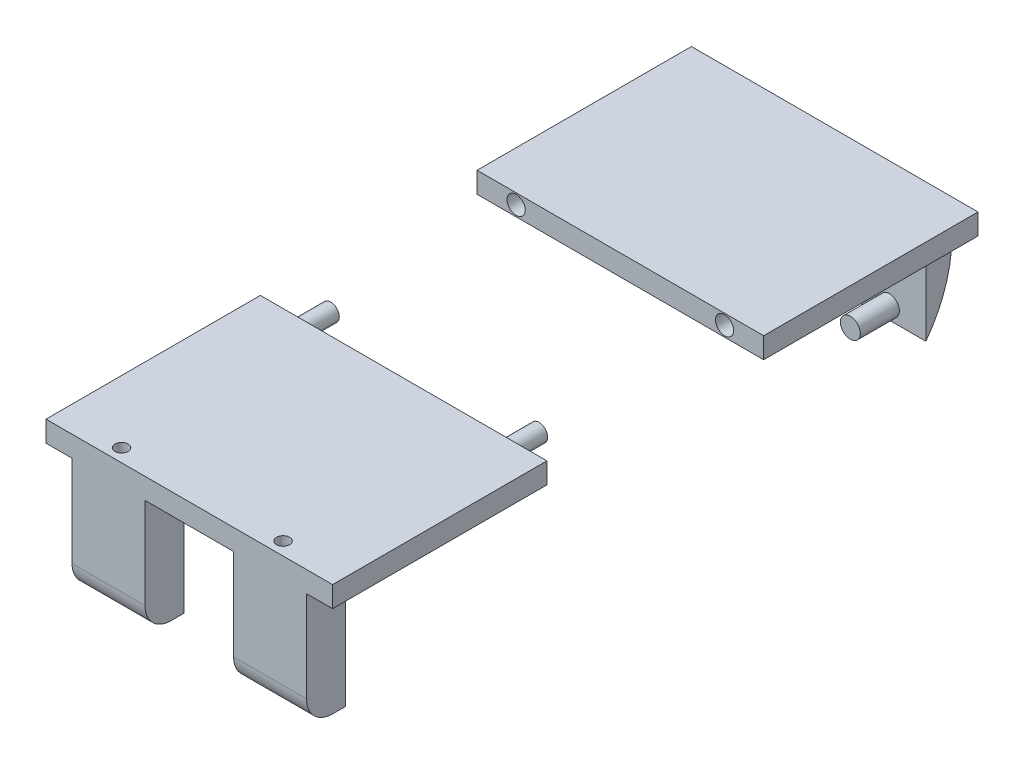
from build123d import *

# Parameters (mm, degrees)
SKETCH_1_W             = 110
SKETCH_1_H             = 8
EXTRUDE_1_DEPTH        = 164.55
SKETCH_7_W             = 28
SKETCH_7_H             = 15
EXTRUDE_2_DEPTH        = 45
FILLET_1_R             = 10
SKETCH_10_R            = 12.415
CUT_EXTRUDE_3_DEPTH    = 10
SKETCH_11_R            = 2.5
CUT_EXTRUDE_4_DEPTH    = 30
FILLET_1_OF_MIRROR_1_R = 10
SKETCH_13_W            = 28
SKETCH_13_H            = 10
EXTRUDE_3_DEPTH        = 35
FILLET_2_R             = 50
SKETCH_14_R            = 3.825
EXTRUDE_4_DEPTH        = 15
MIRROR_START           = -44.153846154
MIRROR_2_DEPTH         = 28
MIRROR_START_2         = 10
MIRROR_2_2_OUTLINE_R   = 3.825
MIRROR_2_2_DEPTH       = 15
SKETCH5_R              = 3.5
CUT_EXTRUDE2_DEPTH     = 15
SKETCH6_R              = 3.3
BOSS_EXTRUDE1_DEPTH    = 12


with BuildPart() as part:
    # Эскиз1 → Бобышка-Вытянуть1 (new body)
    with BuildSketch(Plane.XY):
        with Locations((0.846153846, 10.153846154)):
            Rectangle(SKETCH_1_W, SKETCH_1_H)
    extrude(amount=EXTRUDE_1_DEPTH)

    # Эскиз7 → Бобышка-Вытянуть2 (add)
    with BuildSketch(Plane.XZ.offset(-6.153846154)):
        with Locations((31.846153846, 157.05)):
            Rectangle(SKETCH_7_W, SKETCH_7_H)
    extrude_2 = extrude(amount=EXTRUDE_2_DEPTH)

    # Скругление1
    fillet_1_edges = [part.edges().sort_by_distance(p)[0] for p in [
        (31.846153846, -38.846153846, 164.55),
    ]]
    fillet(fillet_1_edges, radius=FILLET_1_R)

    # Эскиз10 → Вырез-Вытянуть3 (cut)
    with BuildSketch(Plane(origin=(0, 0, 149.55), x_dir=(-1, 0, 0), z_dir=(0, 0, -1))):
        with Locations((-31.846153846, -22.506407884)):
            Circle(SKETCH_10_R)
    cut_extrude_3 = extrude(amount=-CUT_EXTRUDE_3_DEPTH, mode=Mode.SUBTRACT)

    # Эскиз11 → Вырез-Вытянуть4 (cut)
    with BuildSketch(Plane(origin=(0, 14.153846154, 0), x_dir=(1, 0, 0), z_dir=(0, 1, 0))):
        with Locations(Location((31.846153846, -159.55, 0), (0, 0, 270))):
            Circle(SKETCH_11_R)
    cut_extrude_4 = extrude(amount=-CUT_EXTRUDE_4_DEPTH, mode=Mode.SUBTRACT)

    # Зеркальное отражение1: Бобышка-Вытянуть2, Вырез-Вытянуть3, Вырез-Вытянуть4 across plane
    add(extrude_2.mirror(Plane.ZY.offset(-0.846153846)))
    add(cut_extrude_3.mirror(Plane.ZY.offset(-0.846153846)), mode=Mode.SUBTRACT)
    add(cut_extrude_4.mirror(Plane.ZY.offset(-0.846153846)), mode=Mode.SUBTRACT)

    # Скругление1 of Зеркальное отражение1
    fillet_1_of_mirror_1_edges = [part.edges().sort_by_distance(p)[0] for p in [
        (-30.153846154, -38.846153846, 164.55),
    ]]
    fillet(fillet_1_of_mirror_1_edges, radius=FILLET_1_OF_MIRROR_1_R)

    # Эскиз13 → Бобышка-Вытянуть3 (add)
    with BuildSketch(Plane(origin=(0, 6.153846154, 0), x_dir=(-1, 0, 0), z_dir=(0, -1, 0))):
        with Locations((-31.846153846, -5)):
            Rectangle(SKETCH_13_W, SKETCH_13_H)
    extrude(amount=EXTRUDE_3_DEPTH)

    # Скругление2
    # the kernel refuses this fillet: 50 mm, written as the material it takes off along each edge
    with BuildSketch(Plane(origin=(-57.153846154, -28.846153846, 0), x_dir=(0, 1, 0), z_dir=(1, 0, 0))) as fillet_2_piece_1:
        with BuildLine():
            CenterArc((30, 50), FILLET_2_R, 233.130102354, 36.869897646)
            Line((0, 10), (0, 0))
            Line((0, 0), (30, 0))
        make_face()
    extrude(amount=178, mode=Mode.SUBTRACT)

    # Эскиз14 → Бобышка-Вытянуть4 (add)
    with BuildSketch(Plane.XY.offset(10)):
        with Locations(Location((31.846153846, -23.846153846, 0), (0, 0, 180))):
            Circle(SKETCH_14_R)
    extrude(amount=EXTRUDE_4_DEPTH)

    # Зеркальное отражение2: read off the stored shape, not the designer's step
    # Зеркальное отражение2 outline → Зеркальное отражение2 (add)
    with BuildSketch(Plane.YZ.offset(MIRROR_START)):
        with BuildLine():
            Line((1.153846154, 0), (6.153846154, 0))
            Line((6.153846154, 0), (6.153846154, 10))
            Line((6.153846154, 10), (-28.846153846, 10))
            ThreePointArc((-28.846153846, 10), (-14.657542147, 2.565835097), (1.153846154, 0))
        make_face()
    extrude(amount=MIRROR_2_DEPTH)

    # Mirror 2 2 outline → Mirror 2 2 (add)
    with BuildSketch(Plane.XY.offset(MIRROR_START_2)):
        with Locations((-30.153846154, -23.846153846)):
            Circle(MIRROR_2_2_OUTLINE_R)
    extrude(amount=MIRROR_2_2_DEPTH)


with BuildPart() as body_2:
    # Split1: the piece on the far side of the plane
    add(part.part)
    split(bisect_by=Plane(origin=(0, 0, 82.275), x_dir=(-1, 0, 0), z_dir=(0, 0, -1)), keep=Keep.BOTTOM)

    # Sketch6 → Boss-Extrude1 (add)
    with BuildSketch(Plane(origin=(0, 0, 82.275), x_dir=(-1, 0, 0), z_dir=(0, 0, -1))):
        with Locations((39.153846154, 10.153846154)):
            Circle(SKETCH6_R)
    boss_extrude1 = extrude(amount=BOSS_EXTRUDE1_DEPTH)

    # Mirror2: Boss-Extrude1 across plane
    add(boss_extrude1.mirror(Plane.ZY.offset(-0.846153846)))


with BuildPart() as part_1:
    add(part.part)

    # Split1
    split(bisect_by=Plane(origin=(0, 0, 82.275), x_dir=(-1, 0, 0), z_dir=(0, 0, -1)), keep=Keep.TOP)


with BuildPart() as part_2:
    # Body-Move/Copy1: moved
    add(part_1.part.moved(Location((0, 0, -83.19616445))))

    # Sketch5 → Cut-Extrude2 (cut)
    with BuildSketch(Plane.XY.offset(-0.92116445)):
        with Locations((-39.153846154, 10.153846154)):
            Circle(SKETCH5_R)
    cut_extrude2 = extrude(amount=-CUT_EXTRUDE2_DEPTH, mode=Mode.SUBTRACT)

    # Mirror1: Cut-Extrude2 across plane
    add(cut_extrude2.mirror(Plane.ZY.offset(-0.846153846)), mode=Mode.SUBTRACT)


solid = Compound([body_2.part, part_2.part])
